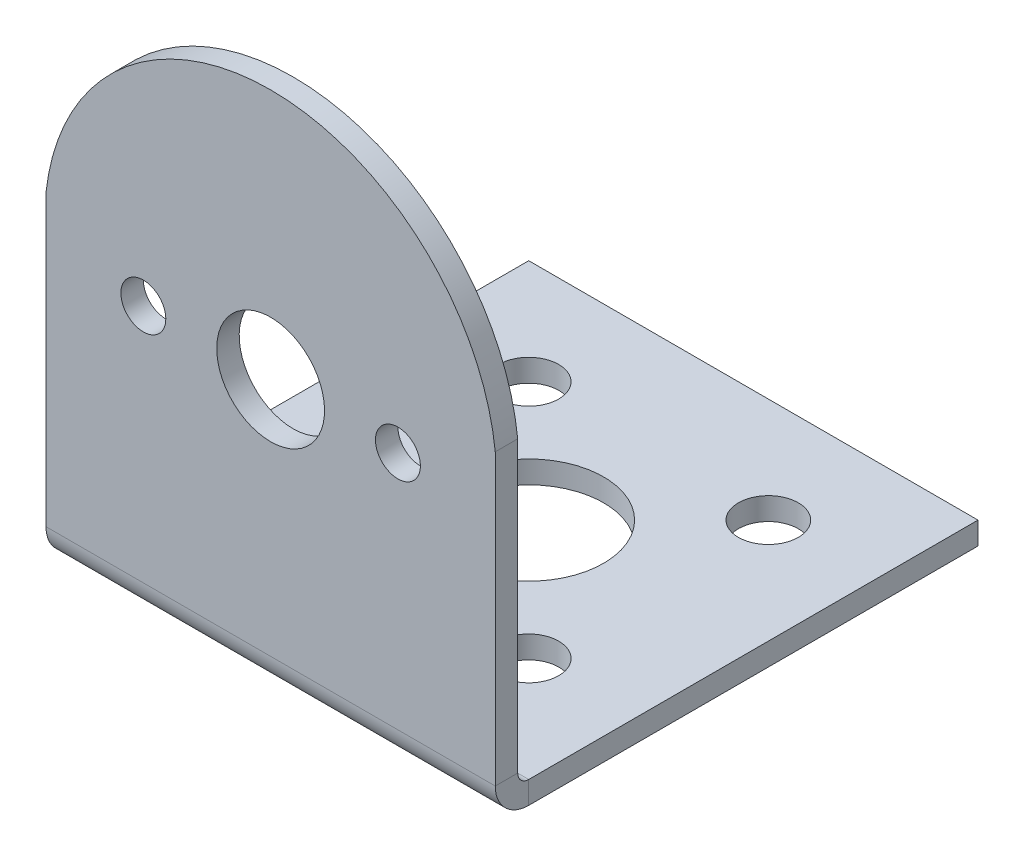
from build123d import *

# Parameters (mm, degrees)
SKETCH1_W                = 30
SKETCH1_H                = 30
SKETCH1_R                = 5
SKETCH1_R_2              = 2
BASE_FLANGE1_DEPTH       = 1.5
EDGE_FLANGE1_DEPTH       = 30
EDGE_FLANGE1_START       = -1.5
EDGE_FLANGE1_PROFILE_R   = 1.5
EDGE_FLANGE1_PROFILE_R_2 = 3.6
EDGE_FLANGE1_FLAT_DEPTH  = 1.5


# Sheet-metal steps are written as plain solids
with BuildPart() as part:
    # Sketch1 → Base-Flange1 (new body)
    with BuildSketch(Plane(origin=(0, 0, 0), x_dir=(1, 0, 0), z_dir=(0, 1, 0))):
        Rectangle(SKETCH1_W, SKETCH1_H)
        with Locations(Location((0, 0, 0), (0, 0, 270))):
            Circle(SKETCH1_R, mode=Mode.SUBTRACT)
        with Locations(Location((8, 8, 0), (0, 0, 270))):
            Circle(SKETCH1_R_2, mode=Mode.SUBTRACT)
        with Locations(Location((8, -8, 0), (0, 0, 270))):
            Circle(SKETCH1_R_2, mode=Mode.SUBTRACT)
        with Locations(Location((-8, -8, 0), (0, 0, 90))):
            Circle(SKETCH1_R_2, mode=Mode.SUBTRACT)
        with Locations(Location((-8, 8, 0), (0, 0, 90))):
            Circle(SKETCH1_R_2, mode=Mode.SUBTRACT)
    extrude(amount=-BASE_FLANGE1_DEPTH)

    # Edge-Flange1 bend section (across the edge) → Edge-Flange1 (add)
    with BuildSketch(Plane(origin=(-15, 0, 15.7366), x_dir=(0, 0, -1), z_dir=(1, 0, 0))):
        with BuildLine():
            Line((-1.5, 0.7366), (0, 0.7366))
            ThreePointArc((0, 0.7366), (0.215745145, 0.215745145), (0.7366, 0))
            Line((0.7366, 0), (0.7366, -1.5))
            ThreePointArc((0.7366, -1.5), (-0.844915027, -0.844915027), (-1.5, 0.7366))
        make_face()
    extrude(amount=EDGE_FLANGE1_DEPTH)

    # Edge-Flange1 profile (on flange) → Edge-Flange1 flat (add)
    with BuildSketch(Plane(origin=(0, 0, 15.7366), x_dir=(-1, 0, 0), z_dir=(0, 0, -1)).offset(EDGE_FLANGE1_START)):
        with BuildLine():
            ThreePointArc((15, 20.067164179), (0, 33.5), (-15, 20.067164179))
            Line((-15, 20.067164179), (-15, 0.7366))
            Line((-15, 0.7366), (15, 0.7366))
            Line((15, 0.7366), (15, 20.067164179))
        make_face()
        with Locations((8.5, 16.75)):
            Circle(EDGE_FLANGE1_PROFILE_R, mode=Mode.SUBTRACT)
        with Locations((0, 16.75)):
            Circle(EDGE_FLANGE1_PROFILE_R_2, mode=Mode.SUBTRACT)
        with Locations((-8.5, 16.75)):
            Circle(EDGE_FLANGE1_PROFILE_R, mode=Mode.SUBTRACT)
    extrude(amount=EDGE_FLANGE1_FLAT_DEPTH)


solid = part.part
